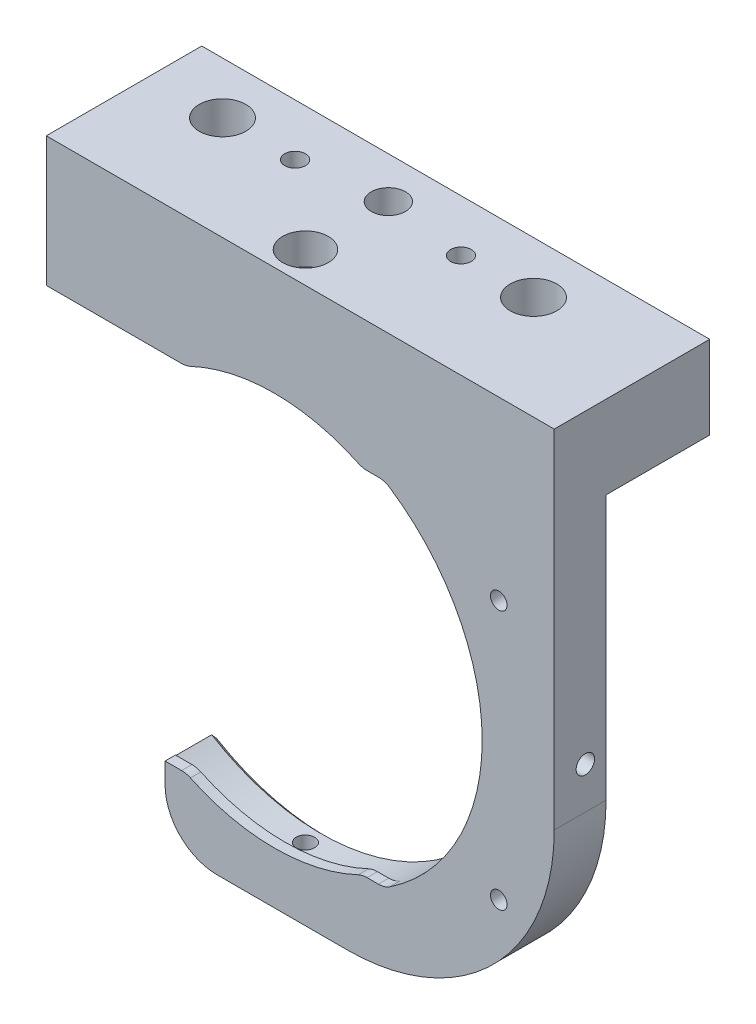
from build123d import *
from build123d.topology import SkipClean

# Parameters (mm, degrees)
SKETCH_2_R                = 22
EXTRUDE_1_DEPTH           = 5
SKETCH_5_W                = 7
SKETCH_5_H                = 15
EXTRUDE_2_DEPTH           = 5
HOLE_WIZARD_2_56_3_D      = 1.778
HOLE_WIZARD_2_56_3_DEPTH  = 15
HOLE_WIZARD_2_56_3_TIP    = 0.534165
SKETCH_13_R               = 20.05
CUT_EXTRUDE_2_DEPTH       = 4
SKETCH_14_R               = 19
CUT_EXTRUDE_3_DEPTH       = 2
CUT_EXTRUDE_4_DEPTH       = 38.016888
EXTRUDE_3_REACH           = 58.225
EXTRUDE_3_END_RADIUS      = 22
SKETCH_16_W               = 18.5
SKETCH_16_H               = 5
FILLET_1_R                = 2
CHAMFER_1_SIZE            = 0.5
SKETCH_26_W               = 11.46
SKETCH_26_H               = 38.490745
CUT_EXTRUDE_5_DEPTH       = 38.138255
SKETCH_27_W               = 44
SKETCH_27_H               = 8
EXTRUDE_4_DEPTH           = 10
HOLE_WIZARD_2_D           = 4.5
HOLE_WIZARD_2_DEPTH       = 10.1
HOLE_WIZARD_2_CBORE_D     = 8
HOLE_WIZARD_2_CBORE_DEPTH = 4.6
HOLE_WIZARD_2_TIP         = 1.351936
EXTRUDE_5_DEPTH           = 5
EXTRUDE_6_REACH           = 60.062
EXTRUDE_6_END_RADIUS      = 22
SKETCH_32_W               = 5
SKETCH_32_H               = 22
MM_4_D                    = 2
MM_4_DEPTH                = 4
MM_4_TIP                  = 0.600861
SKETCH_41_R               = 2.2
CUT_EXTRUDE_6_DEPTH       = 3
SKETCH_45_W               = 27
SKETCH_45_H               = 5
EXTRUDE_7_DEPTH           = 2
EXTRUDE_9_REACH           = 62.756
SKETCH_47_W               = 10.54
SKETCH_47_H               = 5
HOLE_WIZARD_2_56_1_D      = 1.778
HOLE_WIZARD_2_56_1_DEPTH  = 5.73
HOLE_WIZARD_2_56_1_TIP    = 0.534165
FILLET_7_R                = 20
FILLET_8_R                = 5
HOLE_WIZARD_2_56_2_D      = 1.778
HOLE_WIZARD_M4_2_D        = 3.3
HOLE_WIZARD_M2_10_D       = 1.6


with BuildPart() as part:
    # 草图2 → 凸台-拉伸1 (new body)
    with BuildSketch(Plane.XY):
        Circle(SKETCH_2_R)
    extrude(amount=EXTRUDE_1_DEPTH)

    # 草图5 → 凸台-拉伸2 (add)
    with BuildSketch(Plane.XY.offset(5)):
        with Locations((0, 22)):
            Rectangle(SKETCH_5_W, SKETCH_5_H)
    extrude(amount=-EXTRUDE_2_DEPTH)

    # #2-56 螺纹孔3
    with Locations(Plane(origin=(0, 29.5, 2), x_dir=(0, 0, 1), z_dir=(0, 1, 0))):
        with Locations((0, 0)):
            Hole(HOLE_WIZARD_2_56_3_D / 2, depth=HOLE_WIZARD_2_56_3_DEPTH)
            with Locations((0, 0, -(HOLE_WIZARD_2_56_3_DEPTH + HOLE_WIZARD_2_56_3_TIP / 2))):  # 118° drill point
                Cone(0, HOLE_WIZARD_2_56_3_D / 2, HOLE_WIZARD_2_56_3_TIP, mode=Mode.SUBTRACT)

    # 草图13 → 切除-拉伸2 (cut)
    with BuildSketch(Plane(origin=(0, 0, 0), x_dir=(-1, 0, 0), z_dir=(0, 0, -1))):
        Circle(SKETCH_13_R)
    extrude(amount=-CUT_EXTRUDE_2_DEPTH, mode=Mode.SUBTRACT)

    # 草图14 → 切除-拉伸3 (cut)
    with BuildSketch(Plane(origin=(0, 0, 4), x_dir=(-1, 0, 0), z_dir=(0, 0, -1))):
        Circle(SKETCH_14_R)
    extrude(amount=-CUT_EXTRUDE_3_DEPTH, mode=Mode.SUBTRACT)

    # 草图15 → 切除-拉伸4 (cut, through all)
    with SkipClean():  # the faces are left unmerged after this step: merging them gives an invalid solid
        with BuildSketch(Plane(origin=(0, 0, 4), x_dir=(-1, 0, 0), z_dir=(0, 0, -1))):
            with BuildLine():
                Line((-10.630263, 17), (10.630263, 17))
                ThreePointArc((10.630263, 17), (20.05, 0), (10.630263, -17))
                Line((10.630263, -17), (-10.630263, -17))
                ThreePointArc((-10.630263, -17), (-20.05, 0), (-10.630263, 17))
            make_face()
        extrude(amount=-CUT_EXTRUDE_4_DEPTH, mode=Mode.SUBTRACT)

    # 凸台-拉伸3: up to this cylinder (the profile starts outside it)
    with SkipClean():  # the faces are left unmerged after this step: merging them gives an invalid solid
        extrude_3_end = Plane(origin=(0, 0, 2.5), z_dir=(0, 0, -1)) * Cylinder(EXTRUDE_3_END_RADIUS, 161.45, mode=Mode.PRIVATE)
        # 草图16 → 凸台-拉伸3 (add, up to the surface)
        with BuildSketch(Plane(origin=(0, 29.5, 0), x_dir=(1, 0, 0), z_dir=(0, 1, 0)), mode=Mode.PRIVATE) as extrude_3_sk1:
            with Locations((-12.75, -2.5)):
                Rectangle(SKETCH_16_W, SKETCH_16_H)
        extrude_3_tool1 = extrude(extrude_3_sk1.sketch, amount=-EXTRUDE_3_REACH, mode=Mode.PRIVATE) - extrude_3_end
        add(extrude_3_tool1.solids().sort_by_distance((-12.75, 29.5, 2.5))[0])
        # 草图16 → 凸台-拉伸3 (add, up to the surface)
        with BuildSketch(Plane(origin=(0, 29.5, 0), x_dir=(1, 0, 0), z_dir=(0, 1, 0)), mode=Mode.PRIVATE) as extrude_3_sk2:
            with Locations((12.75, -2.5)):
                Rectangle(SKETCH_16_W, SKETCH_16_H)
        extrude_3_tool2 = extrude(extrude_3_sk2.sketch, amount=-EXTRUDE_3_REACH, mode=Mode.PRIVATE) - extrude_3_end
        add(extrude_3_tool2.solids().sort_by_distance((12.75, 29.5, 2.5))[0])

    # 圆角1
    fillet_1_edges = [part.edges().sort_by_distance(p)[0] for p in [
        (8.485281, -17, 4.5),
        (-8.485281, -17, 4.5),
        (-8.485281, 17, 4.5),
        (8.485281, 17, 4.5),
        (10.630263, 17, 4.5),
        (10.630263, -17, 4.5),
    ]]
    fillet(fillet_1_edges, radius=FILLET_1_R)

    # 倒角1
    chamfer_1_edges = [part.edges().sort_by_distance(p)[0] for p in [
        (20.05, 0, 0),
    ]]
    chamfer(chamfer_1_edges, length=CHAMFER_1_SIZE)

    # 草图26 → 切除-拉伸5 (cut, through all)
    with SkipClean():  # the faces are left unmerged after this step: merging them gives an invalid solid
        with BuildSketch(Plane.XY.offset(5)):
            with Locations((-16.27, -2.245373)):
                Rectangle(SKETCH_26_W, SKETCH_26_H)
        extrude(amount=-CUT_EXTRUDE_5_DEPTH, mode=Mode.SUBTRACT)

    # 草图27 → 凸台-拉伸4 (add)
    with SkipClean():  # the faces are left unmerged after this step: merging them gives an invalid solid
        with BuildSketch(Plane(origin=(0, 0, 0), x_dir=(-1, 0, 0), z_dir=(0, 0, -1))):
            with Locations((0, 25.5)):
                Rectangle(SKETCH_27_W, SKETCH_27_H)
        extrude(amount=EXTRUDE_4_DEPTH)

    # 打孔尺寸(%根据)内六角圆柱头螺钉的类型2
    with Locations(Plane(origin=(-15, 21.5, -5), x_dir=(-1, 0, 0), z_dir=(0, -1, 0))):
        with Locations((0, 0), (-30, 0)):
            CounterBoreHole(HOLE_WIZARD_2_D / 2, HOLE_WIZARD_2_CBORE_D / 2, HOLE_WIZARD_2_CBORE_DEPTH, depth=HOLE_WIZARD_2_DEPTH)
            with Locations((0, 0, -(HOLE_WIZARD_2_DEPTH + HOLE_WIZARD_2_TIP / 2))):  # 118° drill point
                Cone(0, HOLE_WIZARD_2_D / 2, HOLE_WIZARD_2_TIP, mode=Mode.SUBTRACT)

    # 草图31 → 凸台-拉伸5 (add)
    with SkipClean():  # the faces are left unmerged after this step: merging them gives an invalid solid
        with BuildSketch(Plane(origin=(22, 0, 0), x_dir=(0, 0, -1), z_dir=(1, 0, 0))):
            Polygon((-5, 0), (0, 0), (0, 21.5), (10, 21.5), (10, 29.5), (-5, 29.5), align=None)
        extrude(amount=EXTRUDE_5_DEPTH)

    # 凸台-拉伸6: up to this cylinder (the profile starts outside it)
    with SkipClean():  # the faces are left unmerged after this step: merging them gives an invalid solid
        extrude_6_end = Plane(origin=(0, 0, 2.5), z_dir=(0, 0, -1)) * Cylinder(EXTRUDE_6_END_RADIUS, 165.124, mode=Mode.PRIVATE)
        # 草图32 → 凸台-拉伸6 (add, up to the surface)
        with BuildSketch(Plane(origin=(27, 0, 0), x_dir=(0, 0, -1), z_dir=(1, 0, 0)), mode=Mode.PRIVATE) as extrude_6_sk1:
            with Locations((-2.5, -11)):
                Rectangle(SKETCH_32_W, SKETCH_32_H)
        extrude_6_tool1 = extrude(extrude_6_sk1.sketch, amount=-EXTRUDE_6_REACH, mode=Mode.PRIVATE) - extrude_6_end
        add(extrude_6_tool1.solids().sort_by_distance((27, -11, 2.5))[0])

    # 大小mm 暗销孔4
    with Locations(Plane(origin=(-8, 29.5, -5), x_dir=(0, 0, 1), z_dir=(0, 1, 0))):
        with Locations((0, 0), (0, 16)):
            Hole(MM_4_D / 2, depth=MM_4_DEPTH)
            with Locations((0, 0, -(MM_4_DEPTH + MM_4_TIP / 2))):  # 118° drill point
                Cone(0, MM_4_D / 2, MM_4_TIP, mode=Mode.SUBTRACT)

    # 草图41 → 切除-拉伸6 (cut)
    with SkipClean():  # the faces are left unmerged after this step: merging them gives an invalid solid
        with BuildSketch(Plane(origin=(0, 29.5, 0), x_dir=(1, 0, 0), z_dir=(0, 1, 0))):
            with Locations(Location((0, -2, 0), (0, 0, 270))):
                Circle(SKETCH_41_R)
        extrude(amount=-CUT_EXTRUDE_6_DEPTH, mode=Mode.SUBTRACT)

    # 草图45 → 凸台-拉伸7 (add)
    with SkipClean():  # the faces are left unmerged after this step: merging them gives an invalid solid
        with BuildSketch(Plane.XZ.offset(22)):
            with Locations((13.5, 2.5)):
                Rectangle(SKETCH_45_W, SKETCH_45_H)
        extrude(amount=EXTRUDE_7_DEPTH)

    # 草图47 → 凸台-拉伸9 (add, up to next)
    with BuildSketch(Plane.XZ.offset(24), mode=Mode.PRIVATE) as extrude_9_sk1:
        with Locations((-5.27, 2.5)):
            Rectangle(SKETCH_47_W, SKETCH_47_H)
    extrude_9_tool1 = extrude(extrude_9_sk1.sketch, amount=-EXTRUDE_9_REACH, mode=Mode.PRIVATE) - part.part
    add(extrude_9_tool1.solids().sort_by_distance((-5.27, -24, 2.5))[0])

    # #2-56 螺纹孔1
    with Locations(Plane(origin=(0, -24, 2), x_dir=(0, 0, -1), z_dir=(0, -1, 0))):
        with Locations((0, 0)):
            Hole(HOLE_WIZARD_2_56_1_D / 2, depth=HOLE_WIZARD_2_56_1_DEPTH)
            with Locations((0, 0, -(HOLE_WIZARD_2_56_1_DEPTH + HOLE_WIZARD_2_56_1_TIP / 2))):  # 118° drill point
                Cone(0, HOLE_WIZARD_2_56_1_D / 2, HOLE_WIZARD_2_56_1_TIP, mode=Mode.SUBTRACT)

    # 圆角7
    # the kernel refuses this fillet: 20 mm, written as the material it takes off along each edge
    with BuildSketch(Plane(origin=(27, -24, -50), x_dir=(-1, 0, 0), z_dir=(0, 0, 1))) as fillet_7_piece_1:
        with BuildLine():
            CenterArc((FILLET_7_R, -FILLET_7_R), FILLET_7_R, 90, 90)
            Line((0, -FILLET_7_R), (0, 0))
            Line((0, 0), (FILLET_7_R, 0))
        make_face()
    extrude(amount=105, mode=Mode.SUBTRACT)

    # 圆角8
    # the kernel refuses this fillet: 5 mm, written as the material it takes off along each edge
    with BuildSketch(Plane(origin=(-10.54, -24, -12.5), x_dir=(0, 1, 0), z_dir=(0, 0, 1))) as fillet_8_piece_1:
        with BuildLine():
            CenterArc((FILLET_8_R, -FILLET_8_R), FILLET_8_R, 90, 90)
            Line((0, -FILLET_8_R), (0, 0))
            Line((0, 0), (FILLET_8_R, 0))
        make_face()
    extrude(amount=30, mode=Mode.SUBTRACT)

    # #2-56 螺纹孔2 (through all)
    with Locations(Plane(origin=(27, 0, 2), x_dir=(0, 0, 1), z_dir=(1, 0, 0))):
        with Locations((0, 0)):
            Hole(HOLE_WIZARD_2_56_2_D / 2)

    # M4 螺纹孔2 (through all)
    with Locations(Plane(origin=(0, 21.5, -6), x_dir=(-1, 0, 0), z_dir=(0, -1, 0))):
        with Locations((0, 0)):
            Hole(HOLE_WIZARD_M4_2_D / 2)

    # M2 螺纹孔10 (through all)
    with Locations(Plane(origin=(21.650635, 12.5, 0), x_dir=(-1, 0, 0), z_dir=(0, 0, -1))):
        with Locations((0, 0), (0, -25)):
            Hole(HOLE_WIZARD_M2_10_D / 2)


solid = part.part
